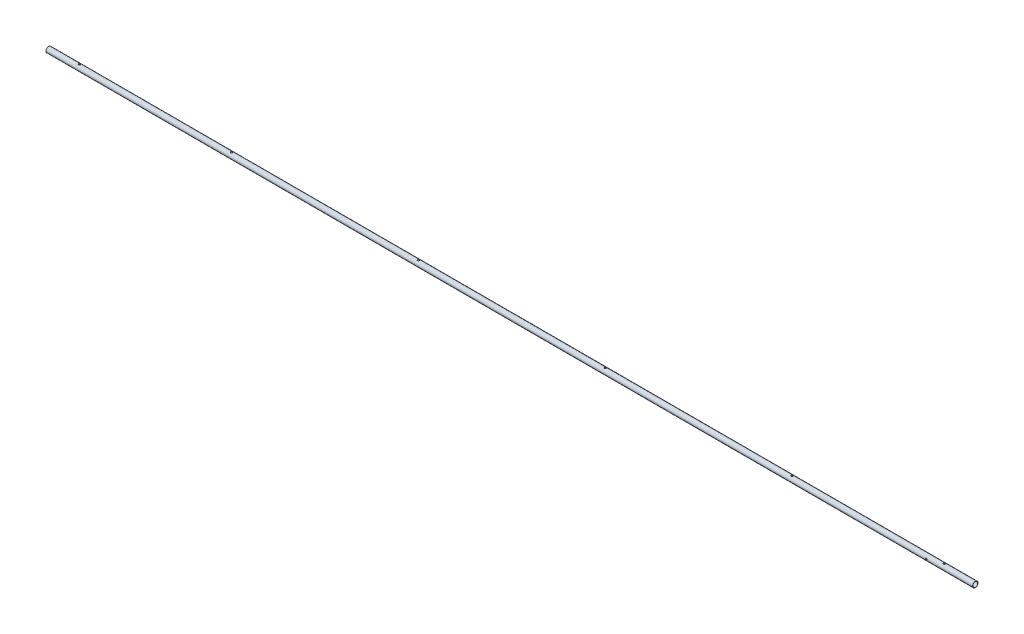
from build123d import *

# Parameters (mm, degrees)
SKETCH1_R               = 8.9662
SKETCH1_R_2             = 7.8994
BOSS_EXTRUDE1_DEPTH     = 3048
CUT_EXTRUDE5_DEPTH      = 3049.026375458
CUT_EXTRUDE5_DEPTH_BACK = 3049.026375458
SKETCH2_R               = 3.175
CUT_EXTRUDE6_DEPTH      = 3049.026375558
CUT_EXTRUDE6_DEPTH_BACK = 3049.026375558
SKETCH3_R               = 3.175


with BuildPart() as part:
    # Sketch1 → Boss-Extrude1 (new body)
    with BuildSketch(Plane(origin=(0, 0, 0), x_dir=(0, 0, -1), z_dir=(1, 0, 0))):
        Circle(SKETCH1_R)
        Circle(SKETCH1_R_2, mode=Mode.SUBTRACT)
    extrude(amount=BOSS_EXTRUDE1_DEPTH)

    # Sketch2 → Cut-Extrude5 (cut, two sides: drawn at the far end of the back side and taken through both)
    with BuildSketch(Plane(origin=(0, 0, 0), x_dir=(1, 0, 0), z_dir=(0, 1, 0)).offset(-CUT_EXTRUDE5_DEPTH_BACK)):
        with Locations((601.98, 0)):
            Circle(SKETCH2_R)
        with Locations((1216.66, 0)):
            Circle(SKETCH2_R)
        with Locations((101.6, 0)):
            Circle(SKETCH2_R)
        with Locations((2946.4, 0)):
            Circle(SKETCH2_R)
        with Locations((2446.02, 0)):
            Circle(SKETCH2_R)
        with Locations((1831.34, 0)):
            Circle(SKETCH2_R)
    extrude(amount=CUT_EXTRUDE5_DEPTH + CUT_EXTRUDE5_DEPTH_BACK, mode=Mode.SUBTRACT)

    # Sketch3 → Cut-Extrude6 (cut, two sides: drawn at the far end of the back side and taken through both)
    with BuildSketch(Plane.XY.offset(-CUT_EXTRUDE6_DEPTH_BACK)):
        with Locations((2895.6, 0)):
            Circle(SKETCH3_R)
    extrude(amount=CUT_EXTRUDE6_DEPTH + CUT_EXTRUDE6_DEPTH_BACK, mode=Mode.SUBTRACT)


solid = part.part
